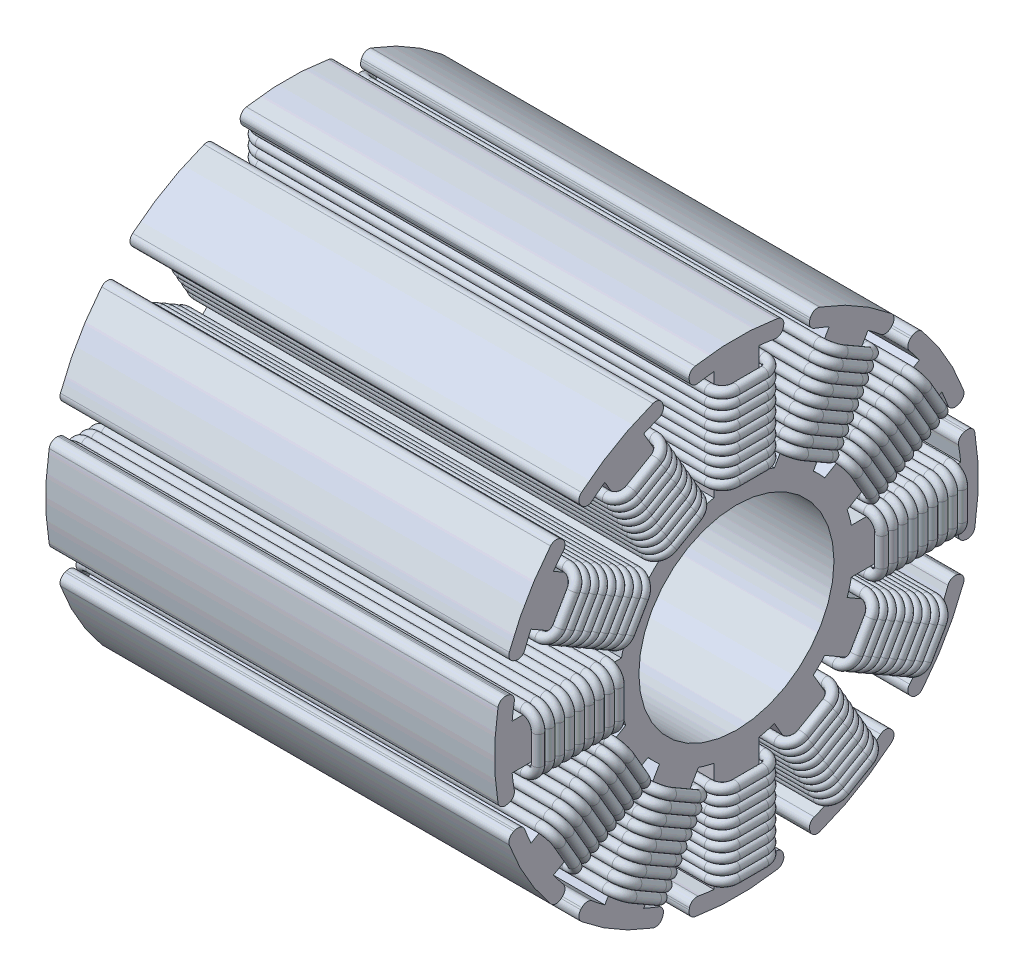
from build123d import *

# Parameters (mm, degrees)
SKETCH1_R           = 12
BOSS_EXTRUDE1_DEPTH = 46
BOSS_EXTRUDE2_START = -46
BOSS_EXTRUDE2_DEPTH = 46
FILLET1_R           = 0.762
SKETCH3_R           = 10
CUT_EXTRUDE1_DEPTH  = 58.845310959
FILLET2_R           = 0.762
SKETCH6_R           = 0.4953
CIRPATTERN8_COUNT   = 12


with BuildPart() as part:
    # Sketch1 → Boss-Extrude1 (new body)
    with BuildSketch(Plane(origin=(0, 0, 0), x_dir=(0, 0, -1), z_dir=(1, 0, 0))):
        Circle(SKETCH1_R)
    extrude(amount=BOSS_EXTRUDE1_DEPTH)

    # Sketch2 → Boss-Extrude2 (add)
    with BuildSketch(Plane(origin=(46, 0, 0), x_dir=(0, 0, -1), z_dir=(1, 0, 0)).offset(BOSS_EXTRUDE2_START)):
        with BuildLine():
            ThreePointArc((5, 24.290738976), (0, 24.8), (-5, 24.290738976))
            Line((-5, 24.290738976), (-4.657258065, 22.625647998))
            ThreePointArc((-4.657258065, 22.625647998), (-3.483271684, 22.835866928), (-2.3, 22.985212638))
            Line((-2.3, 22.985212638), (-2.3, 11.777520962))
            ThreePointArc((-2.3, 11.777520962), (0, 12), (2.3, 11.777520962))
            Line((2.3, 11.777520962), (2.3, 22.985212638))
            ThreePointArc((2.3, 22.985212638), (3.483271684, 22.835866928), (4.657258065, 22.625647998))
            Line((4.657258065, 22.625647998), (5, 24.290738976))
        make_face()
        with BuildLine():
            ThreePointArc((-7.880618909, 9.049632346), (-6, 10.392304845), (-3.896902052, 11.349632346))
            Line((-3.896902052, 11.349632346), (-9.50074789, 21.055778056))
            ThreePointArc((-9.50074789, 21.055778056), (-8.401331697, 21.51807672), (-7.279520203, 21.923014975))
            Line((-7.279520203, 21.923014975), (-7.815242469, 23.53639703))
            ThreePointArc((-7.815242469, 23.53639703), (-12.4, 21.477430014), (-16.475496507, 18.53639703))
            Line((-16.475496507, 18.53639703), (-15.346127795, 17.265756911))
            ThreePointArc((-15.346127795, 17.265756911), (-14.434535231, 18.034805035), (-13.484464748, 18.755778056))
            Line((-13.484464748, 18.755778056), (-7.880618909, 9.049632346))
        make_face()
        with BuildLine():
            Line((9.50074789, 21.055778056), (3.896902052, 11.349632346))
            ThreePointArc((3.896902052, 11.349632346), (6, 10.392304845), (7.880618909, 9.049632346))
            Line((7.880618909, 9.049632346), (13.484464748, 18.755778056))
            ThreePointArc((13.484464748, 18.755778056), (14.434535231, 18.034805035), (15.346127795, 17.265756911))
            Line((15.346127795, 17.265756911), (16.475496507, 18.53639703))
            ThreePointArc((16.475496507, 18.53639703), (12.4, 21.477430014), (7.815242469, 23.53639703))
            Line((7.815242469, 23.53639703), (7.279520203, 21.923014975))
            ThreePointArc((7.279520203, 21.923014975), (8.401331697, 21.51807672), (9.50074789, 21.055778056))
        make_face()
        with BuildLine():
            ThreePointArc((-11.349632346, 3.896902052), (-10.392304845, 6), (-9.049632346, 7.880618909))
            Line((-9.049632346, 7.880618909), (-18.755778056, 13.484464748))
            ThreePointArc((-18.755778056, 13.484464748), (-18.034805035, 14.434535231), (-17.265756911, 15.346127795))
            Line((-17.265756911, 15.346127795), (-18.53639703, 16.475496507))
            ThreePointArc((-18.53639703, 16.475496507), (-21.477430014, 12.4), (-23.53639703, 7.815242469))
            Line((-23.53639703, 7.815242469), (-21.923014975, 7.279520203))
            ThreePointArc((-21.923014975, 7.279520203), (-21.51807672, 8.401331697), (-21.055778056, 9.50074789))
            Line((-21.055778056, 9.50074789), (-11.349632346, 3.896902052))
        make_face()
        with BuildLine():
            Line((18.755778056, 13.484464748), (9.049632346, 7.880618909))
            ThreePointArc((9.049632346, 7.880618909), (10.392304845, 6), (11.349632346, 3.896902052))
            Line((11.349632346, 3.896902052), (21.055778056, 9.50074789))
            ThreePointArc((21.055778056, 9.50074789), (21.51807672, 8.401331697), (21.923014975, 7.279520203))
            Line((21.923014975, 7.279520203), (23.53639703, 7.815242469))
            ThreePointArc((23.53639703, 7.815242469), (21.477430014, 12.4), (18.53639703, 16.475496507))
            Line((18.53639703, 16.475496507), (17.265756911, 15.346127795))
            ThreePointArc((17.265756911, 15.346127795), (18.034805035, 14.434535231), (18.755778056, 13.484464748))
        make_face()
        with BuildLine():
            ThreePointArc((-11.777520962, -2.3), (-12, 0), (-11.777520962, 2.3))
            Line((-11.777520962, 2.3), (-22.985212638, 2.3))
            ThreePointArc((-22.985212638, 2.3), (-22.835866928, 3.483271684), (-22.625647998, 4.657258065))
            Line((-22.625647998, 4.657258065), (-24.290738976, 5))
            ThreePointArc((-24.290738976, 5), (-24.8, 0), (-24.290738976, -5))
            Line((-24.290738976, -5), (-22.625647998, -4.657258065))
            ThreePointArc((-22.625647998, -4.657258065), (-22.835866928, -3.483271684), (-22.985212638, -2.3))
            Line((-22.985212638, -2.3), (-11.777520962, -2.3))
        make_face()
        with BuildLine():
            Line((22.985212638, 2.3), (11.777520962, 2.3))
            ThreePointArc((11.777520962, 2.3), (12, 0), (11.777520962, -2.3))
            Line((11.777520962, -2.3), (22.985212638, -2.3))
            ThreePointArc((22.985212638, -2.3), (22.835866928, -3.483271684), (22.625647998, -4.657258065))
            Line((22.625647998, -4.657258065), (24.290738976, -5))
            ThreePointArc((24.290738976, -5), (24.8, 0), (24.290738976, 5))
            Line((24.290738976, 5), (22.625647998, 4.657258065))
            ThreePointArc((22.625647998, 4.657258065), (22.835866928, 3.483271684), (22.985212638, 2.3))
        make_face()
        with BuildLine():
            ThreePointArc((-9.049632346, -7.880618909), (-10.392304845, -6), (-11.349632346, -3.896902052))
            Line((-11.349632346, -3.896902052), (-21.055778056, -9.50074789))
            ThreePointArc((-21.055778056, -9.50074789), (-21.51807672, -8.401331697), (-21.923014975, -7.279520203))
            Line((-21.923014975, -7.279520203), (-23.53639703, -7.815242469))
            ThreePointArc((-23.53639703, -7.815242469), (-21.477430014, -12.4), (-18.53639703, -16.475496507))
            Line((-18.53639703, -16.475496507), (-17.265756911, -15.346127795))
            ThreePointArc((-17.265756911, -15.346127795), (-18.034805035, -14.434535231), (-18.755778056, -13.484464748))
            Line((-18.755778056, -13.484464748), (-9.049632346, -7.880618909))
        make_face()
        with BuildLine():
            Line((21.055778056, -9.50074789), (11.349632346, -3.896902052))
            ThreePointArc((11.349632346, -3.896902052), (10.392304845, -6), (9.049632346, -7.880618909))
            Line((9.049632346, -7.880618909), (18.755778056, -13.484464748))
            ThreePointArc((18.755778056, -13.484464748), (18.034805035, -14.434535231), (17.265756911, -15.346127795))
            Line((17.265756911, -15.346127795), (18.53639703, -16.475496507))
            ThreePointArc((18.53639703, -16.475496507), (21.477430014, -12.4), (23.53639703, -7.815242469))
            Line((23.53639703, -7.815242469), (21.923014975, -7.279520203))
            ThreePointArc((21.923014975, -7.279520203), (21.51807672, -8.401331697), (21.055778056, -9.50074789))
        make_face()
        with BuildLine():
            ThreePointArc((-3.896902052, -11.349632346), (-6, -10.392304845), (-7.880618909, -9.049632346))
            Line((-7.880618909, -9.049632346), (-13.484464748, -18.755778056))
            ThreePointArc((-13.484464748, -18.755778056), (-14.434535231, -18.034805035), (-15.346127795, -17.265756911))
            Line((-15.346127795, -17.265756911), (-16.475496507, -18.53639703))
            ThreePointArc((-16.475496507, -18.53639703), (-12.4, -21.477430014), (-7.815242469, -23.53639703))
            Line((-7.815242469, -23.53639703), (-7.279520203, -21.923014975))
            ThreePointArc((-7.279520203, -21.923014975), (-8.401331697, -21.51807672), (-9.50074789, -21.055778056))
            Line((-9.50074789, -21.055778056), (-3.896902052, -11.349632346))
        make_face()
        with BuildLine():
            Line((13.484464748, -18.755778056), (7.880618909, -9.049632346))
            ThreePointArc((7.880618909, -9.049632346), (6, -10.392304845), (3.896902052, -11.349632346))
            Line((3.896902052, -11.349632346), (9.50074789, -21.055778056))
            ThreePointArc((9.50074789, -21.055778056), (8.401331697, -21.51807672), (7.279520203, -21.923014975))
            Line((7.279520203, -21.923014975), (7.815242469, -23.53639703))
            ThreePointArc((7.815242469, -23.53639703), (12.4, -21.477430014), (16.475496507, -18.53639703))
            Line((16.475496507, -18.53639703), (15.346127795, -17.265756911))
            ThreePointArc((15.346127795, -17.265756911), (14.434535231, -18.034805035), (13.484464748, -18.755778056))
        make_face()
        with BuildLine():
            ThreePointArc((2.3, -11.777520962), (0, -12), (-2.3, -11.777520962))
            Line((-2.3, -11.777520962), (-2.3, -22.985212638))
            ThreePointArc((-2.3, -22.985212638), (-3.483271684, -22.835866928), (-4.657258065, -22.625647998))
            Line((-4.657258065, -22.625647998), (-5, -24.290738976))
            ThreePointArc((-5, -24.290738976), (0, -24.8), (5, -24.290738976))
            Line((5, -24.290738976), (4.657258065, -22.625647998))
            ThreePointArc((4.657258065, -22.625647998), (3.483271684, -22.835866928), (2.3, -22.985212638))
            Line((2.3, -22.985212638), (2.3, -11.777520962))
        make_face()
    extrude(amount=BOSS_EXTRUDE2_DEPTH)

    # Fillet1
    fillet1_edges = [part.edges().sort_by_distance(p)[0] for p in [
        (23, 17.265756911, 15.346127795),
        (23, 21.923014975, 7.279520203),
        (23, 23.53639703, 7.815242469),
        (23, 18.53639703, 16.475496507),
        (23, 15.346127795, 17.265756911),
        (23, 16.475496507, 18.53639703),
        (23, 7.279520203, 21.923014975),
        (23, 7.815242469, 23.53639703),
        (23, 4.657258065, 22.625647998),
        (23, 5, 24.290738976),
        (23, -5, 24.290738976),
        (23, -4.657258065, 22.625647998),
        (23, -15.346127795, 17.265756911),
        (23, -7.279520203, 21.923014975),
        (23, -7.815242469, 23.53639703),
        (23, -16.475496507, 18.53639703),
        (23, -17.265756911, 15.346127795),
        (23, -18.53639703, 16.475496507),
        (23, -21.923014975, 7.279520203),
        (23, -23.53639703, 7.815242469),
        (23, -24.290738976, 5),
        (23, -22.625647998, 4.657258065),
        (23, -24.290738976, -5),
        (23, -22.625647998, -4.657258065),
        (23, -23.53639703, -7.815242469),
        (23, -21.923014975, -7.279520203),
        (23, -18.53639703, -16.475496507),
        (23, -17.265756911, -15.346127795),
        (23, -16.475496507, -18.53639703),
        (23, -15.346127795, -17.265756911),
        (23, -7.815242469, -23.53639703),
        (23, -7.279520203, -21.923014975),
        (23, -5, -24.290738976),
        (23, -4.657258065, -22.625647998),
        (23, 4.657258065, -22.625647998),
        (23, 5, -24.290738976),
        (23, 7.279520203, -21.923014975),
        (23, 7.815242469, -23.53639703),
        (23, 15.346127795, -17.265756911),
        (23, 16.475496507, -18.53639703),
        (23, 22.625647998, -4.657258065),
        (23, 17.265756911, -15.346127795),
        (23, 18.53639703, -16.475496507),
        (23, 21.923014975, -7.279520203),
        (23, 24.290738976, -5),
        (23, 22.625647998, 4.657258065),
        (23, 24.290738976, 5),
    ]]
    fillet(fillet1_edges, radius=FILLET1_R)

    # Sketch3 → Cut-Extrude1 (cut, through all)
    with BuildSketch(Plane(origin=(46, 0, 0), x_dir=(0, 0, -1), z_dir=(1, 0, 0))):
        Circle(SKETCH3_R)
    extrude(amount=-CUT_EXTRUDE1_DEPTH, mode=Mode.SUBTRACT)

    # Fillet2
    fillet2_edges = [part.edges().sort_by_distance(p)[0] for p in [
        (23, 23.53639703, -7.815242469),
    ]]
    fillet(fillet2_edges, radius=FILLET2_R)


with BuildPart() as body_2:
    # Sweep1: sweep along a path in Sketch5
    with BuildLine(Plane(origin=(0, 10.199632346, 5.888760481), x_dir=(1, 0, 0), z_dir=(0, -0.8660254037844449, -0.49999999999998906))) as sweep1_path:
        Line((46, -2.3), (0, -2.3))
        ThreePointArc((0, -2.3), (-0.595386307, -2.053382917), (-0.84200339, -1.45799661))
        Line((-0.84200339, -1.45799661), (-0.84200339, 1.45799661))
        ThreePointArc((-0.84200339, 1.45799661), (-0.595386307, 2.053382917), (0, 2.3))
        Line((0, 2.3), (46, 2.3))
        ThreePointArc((46, 2.3), (46.595386307, 2.053382917), (46.84200339, 1.45799661))
        Line((46.84200339, 1.45799661), (46.84200339, -1.45799661))
        ThreePointArc((46.84200339, -1.45799661), (46.595386307, -2.053382917), (46, -2.3))
    # Sketch6 → Sweep1 (sweep)
    with BuildSketch(Plane.ZY):
        with Locations((9.187889035, 10.323290623)):
            Circle(SKETCH6_R)
        with Locations((9.695889035, 11.203172433)):
            Circle(SKETCH6_R)
        with Locations((10.203889035, 12.083054243)):
            Circle(SKETCH6_R)
        with Locations((10.711889035, 12.962936054)):
            Circle(SKETCH6_R)
        with Locations((11.219889035, 13.842817864)):
            Circle(SKETCH6_R)
        with Locations((11.727889035, 14.722699674)):
            Circle(SKETCH6_R)
        with Locations((12.235889035, 15.602581484)):
            Circle(SKETCH6_R)
        with Locations((12.743889035, 16.482463295)):
            Circle(SKETCH6_R)
        with Locations((13.251889035, 17.362345105)):
            Circle(SKETCH6_R)
    sweep(path=sweep1_path.line)


with BuildPart() as cirpattern8_1:
    # CirPattern8: pattern copy
    add(body_2.part.rotate(Axis((0, 0, 0), (-1, 0, 0)), 1 * 360 / CIRPATTERN8_COUNT))


with BuildPart() as cirpattern8_2:
    # CirPattern8: pattern copy
    add(body_2.part.rotate(Axis((0, 0, 0), (-1, 0, 0)), 2 * 360 / CIRPATTERN8_COUNT))


with BuildPart() as cirpattern8_3:
    # CirPattern8: pattern copy
    add(body_2.part.rotate(Axis((0, 0, 0), (-1, 0, 0)), 3 * 360 / CIRPATTERN8_COUNT))


with BuildPart() as cirpattern8_4:
    # CirPattern8: pattern copy
    add(body_2.part.rotate(Axis((0, 0, 0), (-1, 0, 0)), 4 * 360 / CIRPATTERN8_COUNT))


with BuildPart() as cirpattern8_5:
    # CirPattern8: pattern copy
    add(body_2.part.rotate(Axis((0, 0, 0), (-1, 0, 0)), 5 * 360 / CIRPATTERN8_COUNT))


with BuildPart() as cirpattern8_6:
    # CirPattern8: pattern copy
    add(body_2.part.rotate(Axis((0, 0, 0), (-1, 0, 0)), 6 * 360 / CIRPATTERN8_COUNT))


with BuildPart() as cirpattern8_7:
    # CirPattern8: pattern copy
    add(body_2.part.rotate(Axis((0, 0, 0), (-1, 0, 0)), 7 * 360 / CIRPATTERN8_COUNT))


with BuildPart() as cirpattern8_8:
    # CirPattern8: pattern copy
    add(body_2.part.rotate(Axis((0, 0, 0), (-1, 0, 0)), 8 * 360 / CIRPATTERN8_COUNT))


with BuildPart() as cirpattern8_9:
    # CirPattern8: pattern copy
    add(body_2.part.rotate(Axis((0, 0, 0), (-1, 0, 0)), 9 * 360 / CIRPATTERN8_COUNT))


with BuildPart() as cirpattern8_10:
    # CirPattern8: pattern copy
    add(body_2.part.rotate(Axis((0, 0, 0), (-1, 0, 0)), 10 * 360 / CIRPATTERN8_COUNT))


with BuildPart() as cirpattern8_11:
    # CirPattern8: pattern copy
    add(body_2.part.rotate(Axis((0, 0, 0), (-1, 0, 0)), 11 * 360 / CIRPATTERN8_COUNT))


solid = Compound([part.part, body_2.part, cirpattern8_1.part, cirpattern8_2.part, cirpattern8_3.part, cirpattern8_4.part, cirpattern8_5.part, cirpattern8_6.part, cirpattern8_7.part, cirpattern8_8.part, cirpattern8_9.part, cirpattern8_10.part, cirpattern8_11.part])
